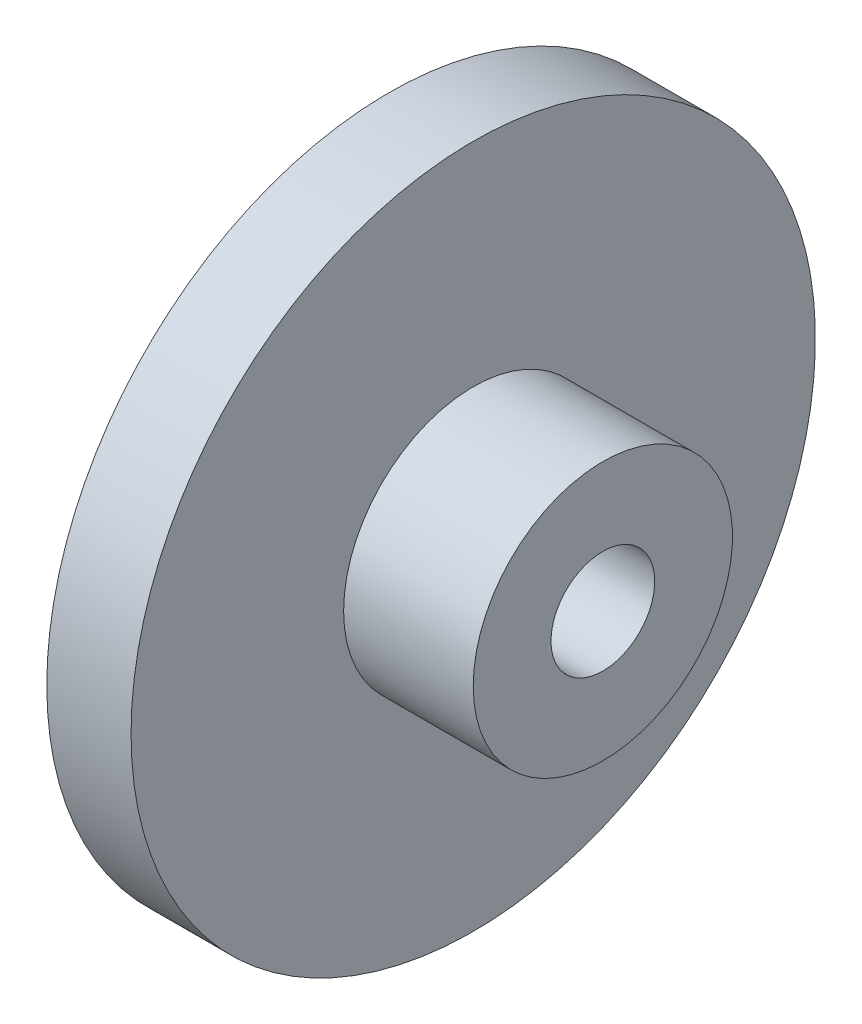
from build123d import *


with BuildPart() as part:
    # Sketch1 → Revolve1 (revolve)
    with BuildSketch(Plane(origin=(0, 0, 0), x_dir=(1, 0, 0), z_dir=(0, 1, 0))):
        Polygon((0, 4), (0, 26.4), (6.5, 26.4), (6.5, 10), (16.5, 10), (16.5, 4), align=None)
    revolve(axis=Axis((-31.608899315, 0, 0), (1, 0, 0)))


solid = part.part
